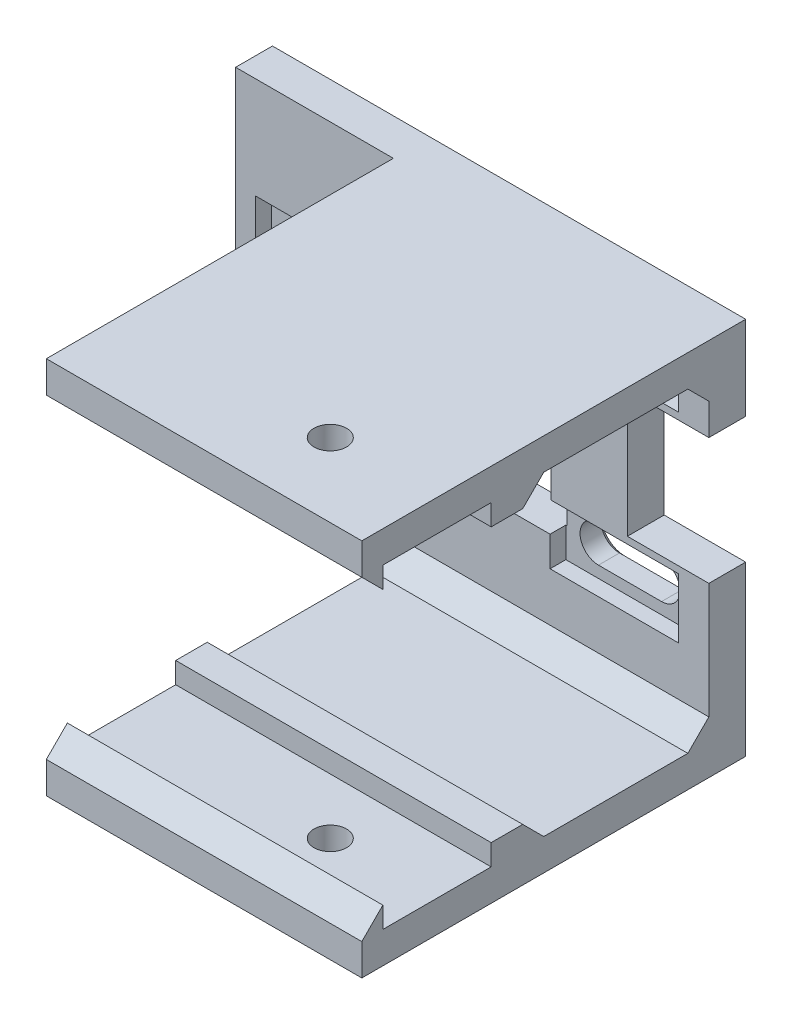
from build123d import *

# Parameters (mm, degrees)
SKETCH1_W                   = 50
SKETCH1_H                   = 36
BOSS_EXTRUDE1_DEPTH         = 4
SKETCH2_W                   = 30
SKETCH2_H                   = 3
BOSS_EXTRUDE2_DEPTH         = 37
SKETCH3_R                   = 1.55
CUT_EXTRUDE1_DEPTH          = 72.867934435
SKETCH4_W                   = 16
SKETCH4_H                   = 11
CUT_EXTRUDE2_DEPTH          = 10
CUT_EXTRUDE3_DEPTH          = 10
SKETCH6_W                   = 20
SKETCH6_H                   = 12
CUT_EXTRUDE4_DEPTH          = 8
SKETCH7_W                   = 30
SKETCH7_H                   = 3
BOSS_EXTRUDE3_DEPTH         = 2
CHAMFER1_SIZE               = 2
CIRPATTERN1_COUNT           = 2
CIRPATTERN1_COPY_1_DEPTH    = 10
SKETCH9_W                   = 5
SKETCH9_H                   = 36
CUT_EXTRUDE6_DEPTH          = 10
CHAMFER2_SIZE               = 0.5
SKETCH10_W                  = 30
SKETCH10_H                  = 2
BOSS_EXTRUDE4_DEPTH         = 2
CHAMFER3_SIZE               = 2
CUT_EXTRUDE7_START          = -1.5
SKETCH12_W                  = 12.2
SKETCH12_H                  = 5.7
CUT_EXTRUDE7_DEPTH          = 7.5
CIRPATTERN2_COUNT           = 2
CIRPATTERN2_START           = -1.5
CIRPATTERN2_COPY_1_SKETCH_W = 12.2
CIRPATTERN2_COPY_1_SKETCH_H = 5.7
CIRPATTERN2_COPY_1_DEPTH    = 7.5
CHAMFER4_SIZE               = 2


with BuildPart() as part:
    # Sketch1 → Boss-Extrude1 (new body)
    with BuildSketch(Plane.XY):
        with Locations((25, 18)):
            Rectangle(SKETCH1_W, SKETCH1_H)
    extrude(amount=BOSS_EXTRUDE1_DEPTH)

    # Sketch2 → Boss-Extrude2 (add)
    with BuildSketch(Plane(origin=(0, 0, 0), x_dir=(-1, 0, 0), z_dir=(0, 0, -1))):
        with Locations((-35, 34.5)):
            Rectangle(SKETCH2_W, SKETCH2_H)
        with Locations((-35, 1.5)):
            Rectangle(SKETCH2_W, SKETCH2_H)
    extrude(amount=-BOSS_EXTRUDE2_DEPTH)

    # Sketch3 → Cut-Extrude1 (cut, through all)
    with BuildSketch(Plane(origin=(0, 36, 0), x_dir=(1, 0, 0), z_dir=(0, 1, 0))):
        with Locations(Location((40, -30, 0), (0, 0, 270))):
            Circle(SKETCH3_R)
    extrude(amount=-CUT_EXTRUDE1_DEPTH, mode=Mode.SUBTRACT)

    # Sketch4 → Cut-Extrude2 (cut)
    with BuildSketch(Plane(origin=(0, 0, 0), x_dir=(-1, 0, 0), z_dir=(0, 0, -1))):
        with Locations((-27, 18)):
            Rectangle(SKETCH4_W, SKETCH4_H)
    extrude(amount=-CUT_EXTRUDE2_DEPTH, mode=Mode.SUBTRACT)

    # Sketch5 → Cut-Extrude3 (cut)
    with BuildSketch(Plane(origin=(0, 0, 0), x_dir=(-1, 0, 0), z_dir=(0, 0, -1))):
        with BuildLine():
            Line((-44, 14.25), (-38, 14.25))
            ThreePointArc((-38, 14.25), (-36.25, 12.5), (-38, 10.75))
            Line((-38, 10.75), (-44, 10.75))
            ThreePointArc((-44, 10.75), (-45.75, 12.5), (-44, 14.25))
        make_face()
    cut_extrude3 = extrude(amount=-CUT_EXTRUDE3_DEPTH, mode=Mode.SUBTRACT)

    # Mirror1: Cut-Extrude3 across plane
    add(cut_extrude3.mirror(Plane.ZX.offset(22)), mode=Mode.SUBTRACT)

    # Sketch6 → Cut-Extrude4 (cut)
    with BuildSketch(Plane(origin=(0, 0, 0), x_dir=(-1, 0, 0), z_dir=(0, 0, -1))):
        with Locations((-52.25, 22)):
            Rectangle(SKETCH6_W, SKETCH6_H)
    cut_extrude4 = extrude(amount=-CUT_EXTRUDE4_DEPTH, mode=Mode.SUBTRACT)

    # Sketch7 → Boss-Extrude3 (add)
    with BuildSketch(Plane(origin=(0, 3, 0), x_dir=(1, 0, 0), z_dir=(0, 1, 0))):
        with Locations((35, -23.2)):
            Rectangle(SKETCH7_W, SKETCH7_H)
    boss_extrude3 = extrude(amount=BOSS_EXTRUDE3_DEPTH)

    # Mirror3: Boss-Extrude3 across plane
    add(boss_extrude3.mirror(Plane.ZX.offset(18)))

    # Chamfer1
    chamfer1_edges = [part.edges().sort_by_distance(p)[0] for p in [
        (35, 33, 21.7),
        (35, 3, 21.7),
    ]]
    chamfer(chamfer1_edges, length=CHAMFER1_SIZE - 0.0001)  # a hair under: the kernel refuses the full size

    # CirPattern1: Cut-Extrude3, Cut-Extrude4 ×2 about axis
    cirpattern1_axis = Axis((27, 18, 0), (0, 0, 1))
    add([cut_extrude3.rotate(cirpattern1_axis, i * 360 / CIRPATTERN1_COUNT) for i in range(1, CIRPATTERN1_COUNT)], mode=Mode.SUBTRACT)
    add([cut_extrude4.rotate(cirpattern1_axis, i * 360 / CIRPATTERN1_COUNT) for i in range(1, CIRPATTERN1_COUNT)], mode=Mode.SUBTRACT)

    # CirPattern1 copy 1 sketch → CirPattern1 copy 1 (cut)
    with BuildSketch(Plane(origin=(54, -8, 0), x_dir=(1, 0, 0), z_dir=(0, 0, -1))):
        with BuildLine():
            Line((-44, -14.25), (-38, -14.25))
            ThreePointArc((-38, -14.25), (-36.25, -12.5), (-38, -10.75))
            Line((-38, -10.75), (-44, -10.75))
            ThreePointArc((-44, -10.75), (-45.75, -12.5), (-44, -14.25))
        make_face()
    extrude(amount=-CIRPATTERN1_COPY_1_DEPTH, mode=Mode.SUBTRACT)

    # Sketch9 → Cut-Extrude6 (cut)
    with BuildSketch(Plane(origin=(0, 0, 0), x_dir=(-1, 0, 0), z_dir=(0, 0, -1))):
        with Locations((-2.5, 18)):
            Rectangle(SKETCH9_W, SKETCH9_H)
    extrude(amount=-CUT_EXTRUDE6_DEPTH, mode=Mode.SUBTRACT)

    # Chamfer2
    chamfer2_edges = [part.edges().sort_by_distance(p)[0] for p in [
        (41, 29.75, 0),
        (45.75, 31.5, 0),
        (36.25, 31.5, 0),
        (41, 33.25, 0),
        (50, 32, 0),
        (46.125, 28, 0),
        (46.125, 16, 0),
        (42.25, 22, 0),
        (8.25, 23.5, 0),
        (13, 25.25, 0),
        (17.75, 23.5, 0),
        (13, 21.75, 0),
        (8.25, 4.5, 0),
        (13, 2.75, 0),
        (17.75, 4.5, 0),
        (13, 6.25, 0),
        (8.375, 8, 0),
        (11.75, 14, 0),
        (8.375, 20, 0),
        (27.5, 0, 0),
        (5, 28, 0),
        (5, 4, 0),
        (27.5, 36, 0),
        (50, 8, 0),
        (35, 18, 0),
        (27, 12.5, 0),
        (19, 18, 0),
        (27, 23.5, 0),
        (45.75, 12.5, 0),
        (41, 10.75, 0),
        (36.25, 12.5, 0),
        (41, 14.25, 0),
    ]]
    chamfer(chamfer2_edges, length=CHAMFER2_SIZE)

    # Sketch10 → Boss-Extrude4 (add)
    with BuildSketch(Plane(origin=(0, 3, 0), x_dir=(1, 0, 0), z_dir=(0, 1, 0))):
        with Locations((35, -36)):
            Rectangle(SKETCH10_W, SKETCH10_H)
    boss_extrude4 = extrude(amount=BOSS_EXTRUDE4_DEPTH)

    # Mirror4: Boss-Extrude4 across plane
    add(boss_extrude4.mirror(Plane.ZX.offset(18)))

    # Chamfer3
    chamfer3_edges = [part.edges().sort_by_distance(p)[0] for p in [
        (35, 31, 37),
        (35, 5, 37),
    ]]
    chamfer(chamfer3_edges, length=CHAMFER3_SIZE - 0.0001)  # a hair under: the kernel refuses the full size

    # Sketch12 → Cut-Extrude7 (cut)
    with BuildSketch(Plane.XY.offset(4).offset(CUT_EXTRUDE7_START)):
        with Locations((13, 23.5)):
            Rectangle(SKETCH12_W, SKETCH12_H)
    cut_extrude7 = extrude(amount=CUT_EXTRUDE7_DEPTH, mode=Mode.SUBTRACT)

    # Mirror5: Cut-Extrude7 across plane
    add(cut_extrude7.mirror(Plane(origin=(0, 14, 0), x_dir=(0, 0, 1), z_dir=(0, -1, 0))), mode=Mode.SUBTRACT)

    # CirPattern2: Cut-Extrude7 ×2 about axis
    cirpattern2_axis = Axis((27, 18, 0), (0, 0, 1))
    for i in range(1, CIRPATTERN2_COUNT):
        add(cut_extrude7.rotate(cirpattern2_axis, i * 360 / CIRPATTERN2_COUNT), mode=Mode.SUBTRACT)

    # CirPattern2 copy 1 sketch → CirPattern2 copy 1 (cut)
    with BuildSketch(Plane(origin=(54, 8, 4), x_dir=(-1, 0, 0), z_dir=(0, 0, 1)).offset(CIRPATTERN2_START)):
        with Locations((13, -23.5)):
            Rectangle(CIRPATTERN2_COPY_1_SKETCH_W, CIRPATTERN2_COPY_1_SKETCH_H)
    extrude(amount=CIRPATTERN2_COPY_1_DEPTH, mode=Mode.SUBTRACT)

    # Chamfer4
    chamfer4_edges = [part.edges().sort_by_distance(p)[0] for p in [
        (48.55, 33, 4),
        (35, 3, 4),
        (27.45, 33, 4),
    ]]
    chamfer(chamfer4_edges, length=CHAMFER4_SIZE)


solid = part.part
